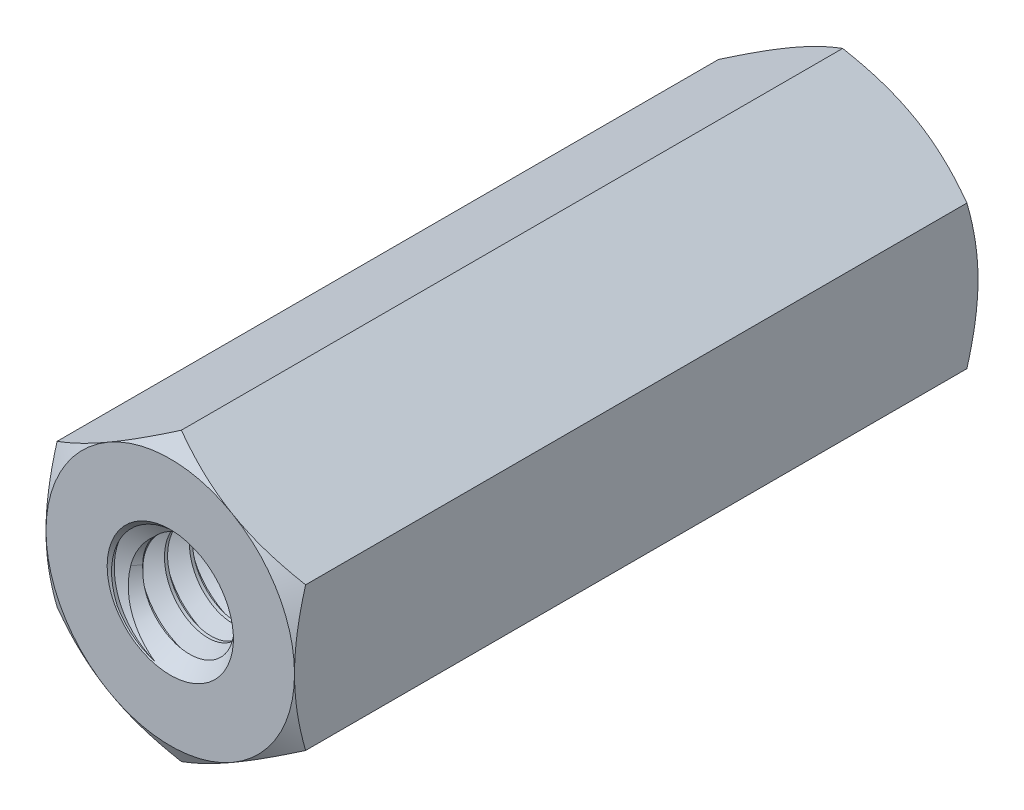
from build123d import *

# Parameters (mm, degrees)
EXTRUDE1_DEPTH          = 17.4625
EXTRUDE1_DEPTH_BACK     = 17.4625
SKETCH1_R               = 3.175
SWEEP1_PITCH            = 1.27
EXTRUDE2_DEPTH          = 38.472341889
SKETCH8_OUTSIDE_W       = 156.186
SKETCH8_OUTSIDE_H       = 158.15
SKETCH8_OUTSIDE_R       = 6.35
EXTRUDE4_DEPTH          = 38.472341889
EXTRUDE4_DRAFT          = -60
MIRROR1_COPY_1_SKETCH_W = 156.186
MIRROR1_COPY_1_SKETCH_H = 158.15
MIRROR1_COPY_1_SKETCH_R = 6.35
MIRROR1_COPY_1_DEPTH    = 38.472341889
MIRROR1_COPY_1_DRAFT    = -60
SKETCH9_W               = 3.175
SKETCH9_H               = 3.2258


with BuildPart() as part:
    # Sketch1 → Extrude1 (new, two sides: drawn at the far end of the back side and taken through both)
    with BuildSketch(Plane.XY.offset(-EXTRUDE1_DEPTH_BACK)):
        Polygon((0, 7.332348419), (-6.35, 3.666174209), (-6.35, -3.666174209), (0, -7.332348419), (6.35, -3.666174209), (6.35, 3.666174209), align=None)
        Circle(SKETCH1_R, mode=Mode.SUBTRACT)
    extrude(amount=EXTRUDE1_DEPTH + EXTRUDE1_DEPTH_BACK)

    # Sweep1: the profile of Sketch12 profile screwed along a right-hand helix of 28.5 turns, 8 arcs to a turn; built about Z, then put on its axis
    sweep1_z = Axis((0, 0, 0), (0, 0, 1))
    sweep1_corners = [(3.1753, 0, -1.111423205), (3.1753, 0, 0.000173205), (2.350110803, 0, -0.47625), (2.350110803, 0, -0.635)]
    with BuildLine(mode=Mode.PRIVATE) as sweep1_profile:
        Line(sweep1_corners[0], sweep1_corners[1])
        Line(sweep1_corners[1], sweep1_corners[2])
        Line(sweep1_corners[2], sweep1_corners[3])
        Line(sweep1_corners[3], sweep1_corners[0])
    sweep1_cap = Face(sweep1_profile.wire())
    sweep1_turn_angles = [0, 22.5, 45, 67.5, 90, 112.5, 135, 157.5, 180, 202.5, 225, 247.5, 270, 292.5, 315, 337.5, 360]
    sweep1_turn_weights = [1, 0.9238795325112867, 1, 0.9238795325112867, 1, 0.9238795325112867, 1, 0.9238795325112867, 1, 0.9238795325112867, 1, 0.9238795325112867, 1, 0.9238795325112867, 1, 0.9238795325112867, 1]
    sweep1_turn_rails = [Edge.make_bspline([Vector(p[0], p[1], 0).rotate(sweep1_z, sweep1_turn_angles[k]) / sweep1_turn_weights[k] + Vector(0, 0, p[2] + SWEEP1_PITCH * sweep1_turn_angles[k] / 360) for k in range(17)], [0, 0, 0, 1, 1, 2, 2, 3, 3, 4, 4, 5, 5, 6, 6, 7, 7, 8, 8, 8], 2, sweep1_turn_weights) for p in sweep1_corners]
    sweep1_turn_sides = [Face.make_surface_from_curves(sweep1_turn_rails[p[0]], sweep1_turn_rails[p[1]]) for p in [(0, 1), (1, 2), (2, 3), (3, 0)]]
    sweep1_last_angles = [10080, 10102.5, 10125, 10147.5, 10170, 10192.5, 10215, 10237.5, 10260]
    sweep1_last_weights = [1, 0.9238795325112867, 1, 0.9238795325112867, 1, 0.9238795325112867, 1, 0.923879532510983, 1]
    sweep1_last_rails = [Edge.make_bspline([Vector(p[0], p[1], 0).rotate(sweep1_z, sweep1_last_angles[k]) / sweep1_last_weights[k] + Vector(0, 0, p[2] + SWEEP1_PITCH * sweep1_last_angles[k] / 360) for k in range(9)], [0, 0, 0, 1, 1, 2, 2, 3, 3, 4, 4, 4], 2, sweep1_last_weights) for p in sweep1_corners]
    sweep1_last_sides = [Face.make_surface_from_curves(sweep1_last_rails[p[0]], sweep1_last_rails[p[1]]) for p in [(0, 1), (1, 2), (2, 3), (3, 0)]]
    sweep1 = Plane(origin=(0, 0, -17.4625), x_dir=(0, 1, 0), z_dir=(0, 0, 1)) * Solid(Shell([*[p.moved(Location((0, 0, SWEEP1_PITCH * i))) for i in range(28) for p in sweep1_turn_sides], *sweep1_last_sides, sweep1_cap, sweep1_cap.rotate(sweep1_z, 10260).moved(Location((0, 0, SWEEP1_PITCH * 10260 / 360)))]))
    add(sweep1)

    # Sketch6 → Extrude2 (cut, through all)
    with BuildSketch(Plane(origin=(0, 0, -17.4625), x_dir=(-1, 0, 0), z_dir=(0, 0, -1))):
        Polygon((0, 7.332348419), (-6.35, 3.666174209), (-6.35, -3.666174209), (0, -7.332348419), (6.35, -3.666174209), (6.35, 3.666174209), align=None)
    extrude2 = extrude(amount=EXTRUDE2_DEPTH, mode=Mode.SUBTRACT)

    # Extrude3 cone 1 section (through the dimple's axis) → Extrude3 (revolve, cut)
    with BuildSketch(Plane(origin=(0, 0, -17.4625), x_dir=(0, 1, 0), z_dir=(1, 0, 0))):
        Polygon((0, 0), (3.2258, 0), (0, 3.459246985), align=None)
    extrude3 = revolve(axis=Axis((0, 0, -17.4625), (0, 0, 1)), mode=Mode.SUBTRACT)


with BuildPart() as extrude4_tool:
    # Sketch8 outside → Extrude4 (with draft: the straight prism first)
    with BuildSketch(Plane(origin=(0, 0, -17.4625), x_dir=(-1, 0, 0), z_dir=(0, 0, -1))):
        Rectangle(SKETCH8_OUTSIDE_W, SKETCH8_OUTSIDE_H)
        Circle(SKETCH8_OUTSIDE_R, mode=Mode.SUBTRACT)
    extrude(amount=-EXTRUDE4_DEPTH)
    # Extrude4: the draft: its side faces are tilted about the plane it starts from
    extrude4_sides = [extrude4_tool.faces().sort_by_distance(p)[0] for p in [
        (0, -79.075, 1.773670945),
        (-78.093, 0, 1.773670945),
        (0, 79.075, 1.773670945),
        (78.093, 0, 1.773670945),
        (6.35, 0, 1.773670945),
    ]]
    draft(extrude4_sides, Plane(origin=(0, 0, -17.4625), x_dir=(-1, 0, 0), z_dir=(0, 0, -1)), EXTRUDE4_DRAFT)


with BuildPart() as part_1:
    add(part.part)

    # Extrude4: cut by extrude4_tool
    add(extrude4_tool.part, mode=Mode.SUBTRACT)

    # Mirror1: Extrude2, Extrude3 across plane
    add(extrude2.mirror(Plane.XY), mode=Mode.SUBTRACT)
    add(extrude3.mirror(Plane.XY), mode=Mode.SUBTRACT)


with BuildPart() as mirror1_copy_1_tool:
    # Mirror1 copy 1 sketch → Mirror1 copy 1 (with draft: the straight prism first)
    with BuildSketch(Plane(origin=(0, 0, 17.4625), x_dir=(-1, 0, 0), z_dir=(0, 0, 1))):
        Rectangle(MIRROR1_COPY_1_SKETCH_W, MIRROR1_COPY_1_SKETCH_H)
        Circle(MIRROR1_COPY_1_SKETCH_R, mode=Mode.SUBTRACT)
    extrude(amount=-MIRROR1_COPY_1_DEPTH)
    # Mirror1 copy 1: the draft: its side faces are tilted about the plane it starts from
    mirror1_copy_1_sides = [mirror1_copy_1_tool.faces().sort_by_distance(p)[0] for p in [
        (0, -79.075, -1.773670945),
        (-78.093, 0, -1.773670945),
        (0, 79.075, -1.773670945),
        (78.093, 0, -1.773670945),
        (6.35, 0, -1.773670945),
    ]]
    draft(mirror1_copy_1_sides, Plane(origin=(0, 0, 17.4625), x_dir=(-1, 0, 0), z_dir=(0, 0, 1)), MIRROR1_COPY_1_DRAFT)


with BuildPart() as part_2:
    add(part_1.part)

    # Mirror1 copy 1: cut by mirror1_copy_1_tool
    add(mirror1_copy_1_tool.part, mode=Mode.SUBTRACT)

    # Sketch9 → Revolve 2 (revolve)
    with BuildSketch(Plane(origin=(0, 0, 0), x_dir=(0, 0, -1), z_dir=(1, 0, 0)), mode=Mode.PRIVATE) as revolve_2_sk:
        with Locations((0, 1.6129)):
            Rectangle(SKETCH9_W, SKETCH9_H)
    revolve(revolve_2_sk.sketch.rotate(Axis((0, 0, 17.4625), (0, 0, -1)), 270), axis=Axis((0, 0, 17.4625), (0, 0, -1)))


solid = part_2.part
